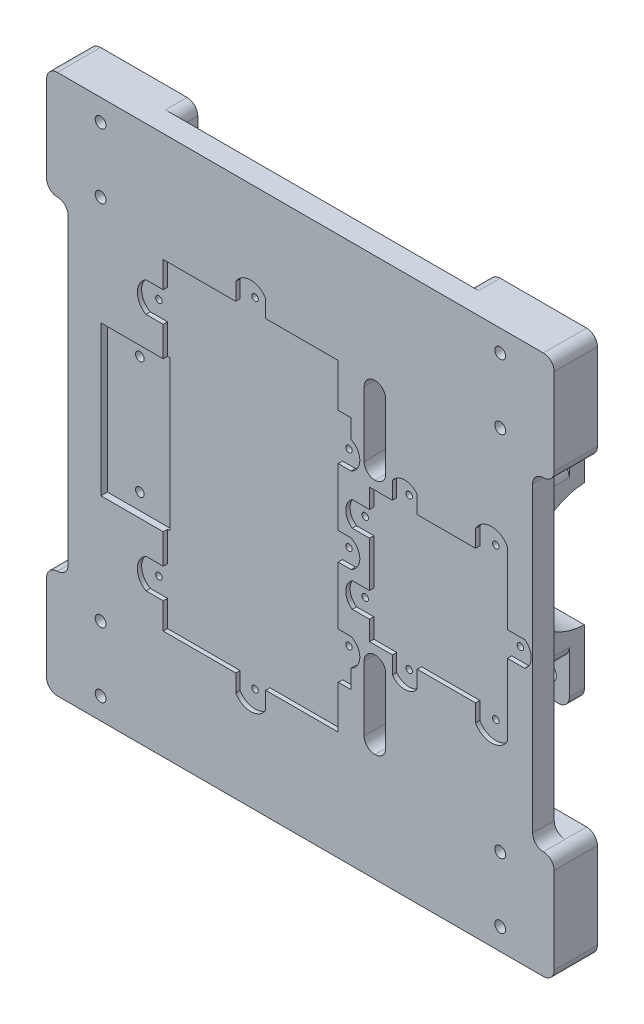
from build123d import *

# Parameters (mm, degrees)
ESQUISSE1_R              = 0.005
ESQUISSE1_W              = 10
ESQUISSE1_H              = 40
BOSS_EXTRU_2_DEPTH       = 10
ESQUISSE4_W              = 50
ESQUISSE4_H              = 50
BOSS_EXTRU_3_DEPTH       = 10
ESQUISSE6_W              = 20
ESQUISSE6_H              = 78
BOSS_EXTRU_5_DEPTH       = 45
CONG_1_R                 = 5
ESQUISSE8_R              = 28.5
ENL_V_MAT_EXTRU_2_DEPTH  = 100
ESQUISSE12_W             = 20
ESQUISSE12_H             = 8
BOSS_EXTRU_6_DEPTH       = 20
ESQUISSE13_W             = 20
ESQUISSE13_H             = 8
BOSS_EXTRU_7_DEPTH       = 20
CONG_55_R                = 5
ESQUISSE14_R             = 4
ENL_V_MAT_EXTRU_4_DEPTH  = 10
ESQUISSE15_W             = 20
ESQUISSE15_H             = 1
ENL_V_MAT_EXTRU_5_DEPTH  = 120
ENL_V_MAT_EXTRU_9_DEPTH  = 10
ESQUISSE23_R             = 2.5
ENL_V_MAT_EXTRU_10_DEPTH = 10
ESQUISSE40_W             = 30
ESQUISSE40_H             = 69.34314575
ENL_V_MAT_EXTRU_27_DEPTH = 3
ESQUISSE41_R             = 2
ENL_V_MAT_EXTRU_28_DEPTH = 10
ESQUISSE43_R             = 1.5
ENL_V_MAT_EXTRU_29_DEPTH = 2
ESQUISSE45_R             = 1.5
ENL_V_MAT_EXTRU_30_DEPTH = 10
CONG_56_R                = 5


with BuildPart() as part:
    # Esquisse1 → Boss.-Extru.2 (new body)
    with BuildSketch(Plane.XY):
        Polygon((235, 50), (235, 0), (0, 0), (0, 50), (10, 50), (10, 200), (0, 200), (0, 250), (235, 250), (235, 200), (225, 200), (225, 50), align=None)
        with Locations((117.5, 125)):
            Circle(ESQUISSE1_R, mode=Mode.SUBTRACT)
        with Locations((152, 70)):
            Rectangle(ESQUISSE1_W, ESQUISSE1_H, mode=Mode.SUBTRACT)
        with Locations((152, 180)):
            Rectangle(ESQUISSE1_W, ESQUISSE1_H, mode=Mode.SUBTRACT)
    extrude(amount=BOSS_EXTRU_2_DEPTH)

    # Esquisse4 → Boss.-Extru.3 (add)
    with BuildSketch(Plane(origin=(0, 0, 0), x_dir=(-1, 0, 0), z_dir=(0, 0, -1))):
        with Locations((-25, 225)):
            Rectangle(ESQUISSE4_W, ESQUISSE4_H)
        with Locations((-210, 225)):
            Rectangle(ESQUISSE4_W, ESQUISSE4_H)
        with Locations((-210, 25)):
            Rectangle(ESQUISSE4_W, ESQUISSE4_H)
        with Locations((-25, 25)):
            Rectangle(ESQUISSE4_W, ESQUISSE4_H)
    extrude(amount=BOSS_EXTRU_3_DEPTH)

    # Esquisse6 → Boss.-Extru.5 (add)
    with BuildSketch(Plane(origin=(0, 0, 0), x_dir=(-1, 0, 0), z_dir=(0, 0, -1))):
        with Locations((-117, 125)):
            Rectangle(ESQUISSE6_W, ESQUISSE6_H)
        with Locations((-185, 125)):
            Rectangle(ESQUISSE6_W, ESQUISSE6_H)
    extrude(amount=BOSS_EXTRU_5_DEPTH)

    # Congé1
    cong_1_edges = [part.edges().sort_by_distance(p)[0] for p in [
        (50, 250, -5),
        (50, 200, -5),
        (185, 250, -5),
        (185, 200, -5),
        (235, 50, 0),
        (235, 200, 0),
        (0, 50, 0),
        (0, 200, 0),
        (225, 50, 5),
        (225, 200, 5),
        (10, 50, 5),
        (10, 200, 5),
        (235, 250, 0),
        (0, 250, 0),
        (0, 0, 0),
        (235, 0, 0),
        (50, 50, -5),
        (185, 50, -5),
        (185, 0, -5),
        (50, 0, -5),
    ]]
    fillet(cong_1_edges, radius=CONG_1_R - 0.0001)  # a hair under: the kernel refuses the full size

    # Esquisse8 → Enlèv. mat.-Extru.2 (cut)
    with BuildSketch(Plane(origin=(195, 0, 0), x_dir=(0, 0, -1), z_dir=(1, 0, 0))):
        with Locations((45, 125)):
            Circle(ESQUISSE8_R)
    extrude(amount=-ENL_V_MAT_EXTRU_2_DEPTH, mode=Mode.SUBTRACT)

    # Esquisse12 → Boss.-Extru.6 (add)
    with BuildSketch(Plane(origin=(0, 164, 0), x_dir=(1, 0, 0), z_dir=(0, 1, 0))):
        with Locations((117, 41)):
            Rectangle(ESQUISSE12_W, ESQUISSE12_H)
        with Locations((185, 41)):
            Rectangle(ESQUISSE12_W, ESQUISSE12_H)
    extrude(amount=BOSS_EXTRU_6_DEPTH)

    # Esquisse13 → Boss.-Extru.7 (add)
    with BuildSketch(Plane.XZ.offset(-86)):
        with Locations((117, -41)):
            Rectangle(ESQUISSE13_W, ESQUISSE13_H)
        with Locations((185, -41)):
            Rectangle(ESQUISSE13_W, ESQUISSE13_H)
    extrude(amount=BOSS_EXTRU_7_DEPTH)

    # Congé55
    cong_55_edges = [part.edges().sort_by_distance(p)[0] for p in [
        (127, 164, -18.5),
        (107, 164, -18.5),
        (107, 184, -41),
        (127, 184, -41),
        (195, 164, -18.5),
        (175, 164, -18.5),
        (175, 184, -41),
        (195, 184, -41),
        (107, 86, -18.5),
        (127, 86, -18.5),
        (107, 66, -41),
        (127, 66, -41),
        (175, 86, -18.5),
        (195, 86, -18.5),
        (175, 66, -41),
        (195, 66, -41),
    ]]
    fillet(cong_55_edges, radius=CONG_55_R)

    # Esquisse14 → Enlèv. mat.-Extru.4 (cut)
    with BuildSketch(Plane(origin=(0, 0, -45), x_dir=(-1, 0, 0), z_dir=(0, 0, -1))):
        with Locations((-185, 173.5)):
            Circle(ESQUISSE14_R)
        with Locations((-117, 173.5)):
            Circle(ESQUISSE14_R)
        with Locations((-117, 76.5)):
            Circle(ESQUISSE14_R)
        with Locations((-185, 76.5)):
            Circle(ESQUISSE14_R)
    extrude(amount=-ENL_V_MAT_EXTRU_4_DEPTH, mode=Mode.SUBTRACT)

    # Esquisse15 → Enlèv. mat.-Extru.5 (cut)
    with BuildSketch(Plane.XZ.offset(-66)):
        with Locations((185, -44.5)):
            Rectangle(ESQUISSE15_W, ESQUISSE15_H)
    extrude(amount=-ENL_V_MAT_EXTRU_5_DEPTH, mode=Mode.SUBTRACT)

    # Esquisse22 → Enlèv. mat.-Extru.9 (cut)
    with BuildSketch(Plane.XY):
        with BuildLine():
            Line((12.5, 245), (37.5, 245))
            ThreePointArc((37.5, 245), (42.5, 240), (37.5, 235))
            Line((37.5, 235), (12.5, 235))
            ThreePointArc((12.5, 235), (7.5, 240), (12.5, 245))
        make_face()
        with BuildLine():
            Line((12.5, 215), (37.5, 215))
            ThreePointArc((37.5, 215), (42.5, 210), (37.5, 205))
            Line((37.5, 205), (12.5, 205))
            ThreePointArc((12.5, 205), (7.5, 210), (12.5, 215))
        make_face()
        with BuildLine():
            Line((12.5, 35), (37.5, 35))
            ThreePointArc((37.5, 35), (42.5, 40), (37.5, 45))
            Line((37.5, 45), (12.5, 45))
            ThreePointArc((12.5, 45), (7.5, 40), (12.5, 35))
        make_face()
        with BuildLine():
            Line((12.5, 5), (37.5, 5))
            ThreePointArc((37.5, 5), (42.5, 10), (37.5, 15))
            Line((37.5, 15), (12.5, 15))
            ThreePointArc((12.5, 15), (7.5, 10), (12.5, 5))
        make_face()
        with BuildLine():
            Line((222.5, 5), (197.5, 5))
            ThreePointArc((197.5, 5), (192.5, 10), (197.5, 15))
            Line((197.5, 15), (222.5, 15))
            ThreePointArc((222.5, 15), (227.5, 10), (222.5, 5))
        make_face()
        with BuildLine():
            Line((222.5, 35), (197.5, 35))
            ThreePointArc((197.5, 35), (192.5, 40), (197.5, 45))
            Line((197.5, 45), (222.5, 45))
            ThreePointArc((222.5, 45), (227.5, 40), (222.5, 35))
        make_face()
        with BuildLine():
            Line((222.5, 245), (197.5, 245))
            ThreePointArc((197.5, 245), (192.5, 240), (197.5, 235))
            Line((197.5, 235), (222.5, 235))
            ThreePointArc((222.5, 235), (227.5, 240), (222.5, 245))
        make_face()
        with BuildLine():
            Line((222.5, 215), (197.5, 215))
            ThreePointArc((197.5, 215), (192.5, 210), (197.5, 205))
            Line((197.5, 205), (222.5, 205))
            ThreePointArc((222.5, 205), (227.5, 210), (222.5, 215))
        make_face()
    extrude(amount=-ENL_V_MAT_EXTRU_9_DEPTH, mode=Mode.SUBTRACT)

    # Esquisse23 → Enlèv. mat.-Extru.10 (cut)
    with BuildSketch(Plane.XY):
        with Locations((25, 240)):
            Circle(ESQUISSE23_R)
        with Locations((25, 210)):
            Circle(ESQUISSE23_R)
        with Locations(Location((25, 40, 0), (0, 0, 180))):
            Circle(ESQUISSE23_R)
        with Locations(Location((25, 10, 0), (0, 0, 180))):
            Circle(ESQUISSE23_R)
        with Locations((210, 10)):
            Circle(ESQUISSE23_R)
        with Locations((210, 40)):
            Circle(ESQUISSE23_R)
        with Locations(Location((210, 210, 0), (0, 0, 180))):
            Circle(ESQUISSE23_R)
        with Locations(Location((210, 240, 0), (0, 0, 180))):
            Circle(ESQUISSE23_R)
    extrude(amount=ENL_V_MAT_EXTRU_10_DEPTH, mode=Mode.SUBTRACT)

    # Esquisse40 → Enlèv. mat.-Extru.27 (cut)
    with BuildSketch(Plane.XY.offset(10)):
        with Locations((40.171572875, 125)):
            Rectangle(ESQUISSE40_W, ESQUISSE40_H)
    extrude(amount=-ENL_V_MAT_EXTRU_27_DEPTH, mode=Mode.SUBTRACT)

    # Esquisse41 → Enlèv. mat.-Extru.28 (cut)
    with BuildSketch(Plane.XY.offset(7)):
        with Locations((40.171572875, 152.171572875)):
            Circle(ESQUISSE41_R)
        with Locations(Location((40.171572875, 97.828427125, 0), (0, 0, 180))):
            Circle(ESQUISSE41_R)
    extrude(amount=-ENL_V_MAT_EXTRU_28_DEPTH, mode=Mode.SUBTRACT)

    # Esquisse43 → Enlèv. mat.-Extru.29 (cut)
    # profile 1 of 2: a face of its own
    with BuildSketch(Plane.XY.offset(10)):
        with BuildLine():
            Line((54, 187.356406461), (54, 199.5))
            Line((54, 199.5), (87.57179677, 199.5))
            Line((87.57179677, 199.5), (87.57179677, 207.5))
            ThreePointArc((87.57179677, 207.5), (94.5, 211.5), (101.42820323, 207.5))
            Line((101.42820323, 207.5), (101.42820323, 199.5))
            Line((101.42820323, 199.5), (135, 199.5))
            Line((135, 199.5), (135, 179.5))
            Line((135, 179.5), (141, 179.5))
            Line((141, 179.5), (141, 170.82455532))
            ThreePointArc((141, 170.82455532), (145, 164.5), (141, 158.17544468))
            Line((141, 158.17544468), (135, 158.17544468))
            Line((135, 158.17544468), (135, 131.32455532))
            Line((135, 131.32455532), (141, 131.32455532))
            ThreePointArc((141, 131.32455532), (145, 125), (141, 118.67544468))
            Line((141, 118.67544468), (135, 118.67544468))
            Line((135, 118.67544468), (135, 91.82455532))
            Line((135, 91.82455532), (141, 91.82455532))
            ThreePointArc((141, 91.82455532), (145, 85.5), (141, 79.17544468))
            Line((141, 79.17544468), (141, 70.5))
            Line((141, 70.5), (135, 70.5))
            Line((135, 70.5), (135, 50.5))
            Line((135, 50.5), (101.42820323, 50.5))
            Line((101.42820323, 50.5), (101.42820323, 42.5))
            ThreePointArc((101.42820323, 42.5), (94.5, 38.5), (87.57179677, 42.5))
            Line((87.57179677, 42.5), (87.57179677, 50.5))
            Line((87.57179677, 50.5), (54, 50.5))
            Line((54, 50.5), (54, 62.643593539))
            Line((54, 62.643593539), (46, 62.643593539))
            ThreePointArc((46, 62.643593539), (42, 69.57179677), (46, 76.5))
            Line((46, 76.5), (54, 76.5))
            Line((54, 76.5), (54, 173.5))
            Line((54, 173.5), (46, 173.5))
            ThreePointArc((46, 173.5), (42, 180.42820323), (46, 187.356406461))
            Line((46, 187.356406461), (54, 187.356406461))
        make_face()
        with Locations((94.5, 203.5)):
            Circle(ESQUISSE43_R, mode=Mode.SUBTRACT)
        with Locations((50, 180.42820323)):
            Circle(ESQUISSE43_R, mode=Mode.SUBTRACT)
        with Locations((138, 164.5)):
            Circle(ESQUISSE43_R, mode=Mode.SUBTRACT)
        with Locations(Location((138, 85.5, 0), (0, 0, 180))):
            Circle(ESQUISSE43_R, mode=Mode.SUBTRACT)
        with Locations((138, 125)):
            Circle(ESQUISSE43_R, mode=Mode.SUBTRACT)
        with Locations(Location((50, 69.57179677, 0), (0, 0, 180))):
            Circle(ESQUISSE43_R, mode=Mode.SUBTRACT)
        with Locations(Location((94.5, 46.5, 0), (0, 0, 180))):
            Circle(ESQUISSE43_R, mode=Mode.SUBTRACT)
    # profile 2 of 2: a face of its own
    with BuildSketch(Plane.XY.offset(10)):
        with BuildLine():
            Line((149.5, 156), (160.097306496, 156))
            Line((160.097306496, 156), (160.097306496, 164))
            ThreePointArc((160.097306496, 164), (165.841869142, 167), (171.586431789, 164))
            Line((171.586431789, 164), (171.586431789, 156))
            Line((171.586431789, 156), (198.586431789, 156))
            Line((198.586431789, 156), (198.586431789, 164))
            ThreePointArc((198.586431789, 164), (205.971275457, 168.398566306), (213.356119125, 164))
            Line((213.356119125, 164), (213.356119125, 130.744562647))
            Line((213.356119125, 130.744562647), (221.356119125, 130.744562647))
            ThreePointArc((221.356119125, 130.744562647), (224.356119125, 125), (221.356119125, 119.255437353))
            Line((221.356119125, 119.255437353), (213.356119125, 119.255437353))
            Line((213.356119125, 119.255437353), (213.356119125, 86))
            ThreePointArc((213.356119125, 86), (205.971275457, 81.601433694), (198.586431789, 86))
            Line((198.586431789, 86), (198.586431789, 94))
            Line((198.586431789, 94), (171.586431789, 94))
            Line((171.586431789, 94), (171.586431789, 86))
            ThreePointArc((171.586431789, 86), (165.841869142, 83), (160.097306496, 86))
            Line((160.097306496, 86), (160.097306496, 94))
            Line((160.097306496, 94), (149.5, 94))
            Line((149.5, 94), (149.5, 103))
            Line((149.5, 103), (141.5, 103))
            ThreePointArc((141.5, 103), (138.5, 108.744562647), (141.5, 114.489125293))
            Line((141.5, 114.489125293), (149.5, 114.489125293))
            Line((149.5, 114.489125293), (149.5, 135.510874707))
            Line((149.5, 135.510874707), (141.5, 135.510874707))
            ThreePointArc((141.5, 135.510874707), (138.5, 141.255437353), (141.5, 147))
            Line((141.5, 147), (149.5, 147))
            Line((149.5, 147), (149.5, 156))
        make_face()
        with Locations(Location((217.356119125, 125, 0), (0, 0, 180))):
            Circle(ESQUISSE43_R, mode=Mode.SUBTRACT)
        with Locations((165.841869142, 160)):
            Circle(ESQUISSE43_R, mode=Mode.SUBTRACT)
        with Locations((205.971275457, 160)):
            Circle(ESQUISSE43_R, mode=Mode.SUBTRACT)
        with Locations((145.5, 141.255437353)):
            Circle(ESQUISSE43_R, mode=Mode.SUBTRACT)
        with Locations(Location((145.5, 108.744562647, 0), (0, 0, 180))):
            Circle(ESQUISSE43_R, mode=Mode.SUBTRACT)
        with Locations(Location((205.971275457, 90, 0), (0, 0, 180))):
            Circle(ESQUISSE43_R, mode=Mode.SUBTRACT)
        with Locations(Location((165.841869142, 90, 0), (0, 0, 180))):
            Circle(ESQUISSE43_R, mode=Mode.SUBTRACT)
    extrude(amount=-ENL_V_MAT_EXTRU_29_DEPTH, mode=Mode.SUBTRACT)

    # Esquisse45 → Enlèv. mat.-Extru.30 (cut)
    with BuildSketch(Plane.XY.offset(10)):
        with Locations((94.5, 203.5)):
            Circle(ESQUISSE45_R)
        with Locations((50, 180.42820323)):
            Circle(ESQUISSE45_R)
        with Locations((138, 164.5)):
            Circle(ESQUISSE45_R)
        with Locations((145.5, 141.255437353)):
            Circle(ESQUISSE45_R)
        with Locations((165.841869142, 160)):
            Circle(ESQUISSE45_R)
        with Locations((205.971275457, 160)):
            Circle(ESQUISSE45_R)
        with Locations((217.356119125, 125)):
            Circle(ESQUISSE45_R)
        with Locations((145.5, 108.744562647)):
            Circle(ESQUISSE45_R)
        with Locations((165.841869142, 90)):
            Circle(ESQUISSE45_R)
        with Locations((205.971275457, 90)):
            Circle(ESQUISSE45_R)
        with Locations((138, 85.5)):
            Circle(ESQUISSE45_R)
        with Locations((138, 125)):
            Circle(ESQUISSE45_R)
        with Locations((94.5, 46.5)):
            Circle(ESQUISSE45_R)
        with Locations((50, 69.57179677)):
            Circle(ESQUISSE45_R)
    extrude(amount=-ENL_V_MAT_EXTRU_30_DEPTH, mode=Mode.SUBTRACT)

    # Congé56
    cong_56_edges = [part.edges().sort_by_distance(p)[0] for p in [
        (147, 50, 5),
        (157, 50, 5),
        (157, 90, 5),
        (147, 90, 5),
        (157, 160, 5),
        (147, 160, 5),
        (157, 200, 5),
        (147, 200, 5),
    ]]
    fillet(cong_56_edges, radius=CONG_56_R - 0.0001)  # a hair under: the kernel refuses the full size


solid = part.part
